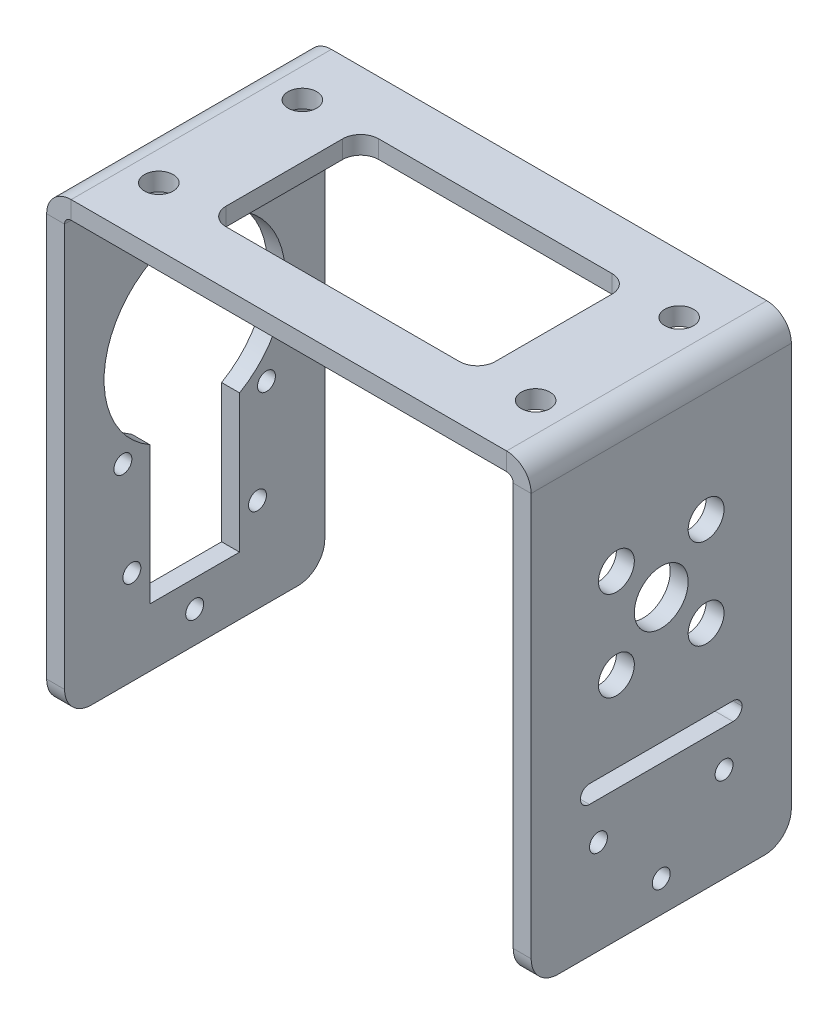
from build123d import *

# Parameters (mm, degrees)
SKETCH_1_W                       = 50
SKETCH_1_H                       = 29
SM_BASE_FLANGE_1_DEPTH           = 2
SM_EDGE_FLANGE_1_STRIP_W         = 9.4732
SM_EDGE_FLANGE_1_STRIP_H         = 2
SM_EDGE_FLANGE_1_STRIP_CUT_DEPTH = 29
SM_EDGE_FLANGE_1_DEPTH           = 29
CUT_EXTRUDE_1_REACH              = 74.671
SKETCH_9_R                       = 1
SM_EDGE_FLANGE_2_STRIP_W         = 9.4732
SM_EDGE_FLANGE_2_STRIP_H         = 2
SM_EDGE_FLANGE_2_STRIP_CUT_DEPTH = 29
SM_EDGE_FLANGE_2_DEPTH           = 29
CUT_EXTRUDE_2_REACH              = 76.115
SKETCH_13_R                      = 3
SKETCH_13_R_2                    = 2
SKETCH_13_R_3                    = 1
SKETCH_13_W                      = 18
SKETCH_13_H                      = 2
FILLET_1_R                       = 3
CUT_EXTRUDE_3_REACH              = 61.2
SKETCH_14_R                      = 1.6
SKETCH_14_W                      = 30
SKETCH_14_H                      = 17
FILLET_2_R                       = 2
EXTRUDE_1_DEPTH                  = 5
FILLET_3_R                       = 1


# Sheet-metal steps are written as plain solids
with BuildPart() as part:
    # Sketch 1 → 基体-法兰1 (new body)
    with BuildSketch(Plane(origin=(0, 0, 0), x_dir=(1, 0, 0), z_dir=(0, 1, 0))):
        Rectangle(SKETCH_1_W, SKETCH_1_H)
    extrude(amount=SM_BASE_FLANGE_1_DEPTH)

    # 边线-法兰1 strip (across the edge) → 边线-法兰1 strip cut (cut)
    with BuildSketch(Plane(origin=(-25, 0, 14.5), x_dir=(1, 0, 0), z_dir=(0, 0, -1))):
        with Locations((-4, -1)):
            Rectangle(SM_EDGE_FLANGE_1_STRIP_W, SM_EDGE_FLANGE_1_STRIP_H)
    extrude(amount=SM_EDGE_FLANGE_1_STRIP_CUT_DEPTH, mode=Mode.SUBTRACT)

    # 边线-法兰1 section (across the edge) → 边线-法兰1 (add)
    with BuildSketch(Plane(origin=(-25, 0, 14.5), x_dir=(1, 0, 0), z_dir=(0, 0, -1))):
        with BuildLine():
            Line((-2, 0.7366), (-2, 48.65))
            Line((-2, 48.65), (0, 48.65))
            Line((0, 48.65), (0, 0.7366))
            ThreePointArc((0, 0.7366), (0.215745145, 0.215745145), (0.7366, 0))
            Line((0.7366, 0), (0.7366, -2))
            ThreePointArc((0.7366, -2), (-1.198468417, -1.198468417), (-2, 0.7366))
        make_face()
    extrude(amount=SM_EDGE_FLANGE_1_DEPTH)

    # 草图9 → 切除-拉伸1 (cut, up to next)
    with BuildSketch(Plane.ZY.offset(27), mode=Mode.PRIVATE) as cut_extrude_1_sk1:
        with Locations(Location((-8, -27.15, 0), (0, 0, 270))):
            Circle(SKETCH_9_R)
    cut_extrude_1_tool1 = extrude(cut_extrude_1_sk1.sketch, amount=-CUT_EXTRUDE_1_REACH, mode=Mode.PRIVATE) & part.part
    # 草图9 → 切除-拉伸1 (cut, up to next)
    with BuildSketch(Plane.ZY.offset(27), mode=Mode.PRIVATE) as cut_extrude_1_sk2:
        with Locations(Location((-7, -38.15, 0), (0, 0, 270))):
            Circle(SKETCH_9_R)
    cut_extrude_1_tool2 = extrude(cut_extrude_1_sk2.sketch, amount=-CUT_EXTRUDE_1_REACH, mode=Mode.PRIVATE) & part.part
    # 草图9 → 切除-拉伸1 (cut, up to next)
    with BuildSketch(Plane.ZY.offset(27), mode=Mode.PRIVATE) as cut_extrude_1_sk3:
        with Locations(Location((0, -45.15, 0), (0, 0, 270))):
            Circle(SKETCH_9_R)
    cut_extrude_1_tool3 = extrude(cut_extrude_1_sk3.sketch, amount=-CUT_EXTRUDE_1_REACH, mode=Mode.PRIVATE) & part.part
    # 草图9 → 切除-拉伸1 (cut, up to next)
    with BuildSketch(Plane.ZY.offset(27), mode=Mode.PRIVATE) as cut_extrude_1_sk4:
        with Locations(Location((7, -38.15, 0), (0, 0, 90))):
            Circle(SKETCH_9_R)
    cut_extrude_1_tool4 = extrude(cut_extrude_1_sk4.sketch, amount=-CUT_EXTRUDE_1_REACH, mode=Mode.PRIVATE) & part.part
    # 草图9 → 切除-拉伸1 (cut, up to next)
    with BuildSketch(Plane.ZY.offset(27), mode=Mode.PRIVATE) as cut_extrude_1_sk5:
        with Locations(Location((8, -27.15, 0), (0, 0, 90))):
            Circle(SKETCH_9_R)
    cut_extrude_1_tool5 = extrude(cut_extrude_1_sk5.sketch, amount=-CUT_EXTRUDE_1_REACH, mode=Mode.PRIVATE) & part.part
    # 草图9 → 切除-拉伸1 (cut, up to next)
    with BuildSketch(Plane.ZY.offset(27), mode=Mode.PRIVATE) as cut_extrude_1_sk6:
        with BuildLine():
            Line((-5, -42.15), (-5, -26.775534172))
            ThreePointArc((-5, -26.775534172), (0, -7.9), (5, -26.775534172))
            Line((5, -26.775534172), (5, -42.15))
            Line((5, -42.15), (-5, -42.15))
        make_face()
    cut_extrude_1_tool6 = extrude(cut_extrude_1_sk6.sketch, amount=-CUT_EXTRUDE_1_REACH, mode=Mode.PRIVATE) & part.part
    add(cut_extrude_1_tool1.solids().sort_by_distance((-27, -27.15, -8))[0], mode=Mode.SUBTRACT)
    add(cut_extrude_1_tool2.solids().sort_by_distance((-27, -38.15, -7))[0], mode=Mode.SUBTRACT)
    add(cut_extrude_1_tool3.solids().sort_by_distance((-27, -45.15, 0))[0], mode=Mode.SUBTRACT)
    add(cut_extrude_1_tool4.solids().sort_by_distance((-27, -38.15, 7))[0], mode=Mode.SUBTRACT)
    add(cut_extrude_1_tool5.solids().sort_by_distance((-27, -27.15, 8))[0], mode=Mode.SUBTRACT)
    add(cut_extrude_1_tool6.solids().sort_by_distance((-27, -23.260924, 0))[0], mode=Mode.SUBTRACT)

    # 边线-法兰2 strip (across the edge) → 边线-法兰2 strip cut (cut)
    with BuildSketch(Plane(origin=(25, 0, -14.5), x_dir=(-1, 0, 0), z_dir=(0, 0, 1))):
        with Locations((-4, -1)):
            Rectangle(SM_EDGE_FLANGE_2_STRIP_W, SM_EDGE_FLANGE_2_STRIP_H)
    extrude(amount=SM_EDGE_FLANGE_2_STRIP_CUT_DEPTH, mode=Mode.SUBTRACT)

    # 边线-法兰2 section (across the edge) → 边线-法兰2 (add)
    with BuildSketch(Plane(origin=(25, 0, -14.5), x_dir=(-1, 0, 0), z_dir=(0, 0, 1))):
        with BuildLine():
            Line((-2, 0.7366), (-2, 48.65))
            Line((-2, 48.65), (0, 48.65))
            Line((0, 48.65), (0, 0.7366))
            ThreePointArc((0, 0.7366), (0.215745145, 0.215745145), (0.7366, 0))
            Line((0.7366, 0), (0.7366, -2))
            ThreePointArc((0.7366, -2), (-1.198468417, -1.198468417), (-2, 0.7366))
        make_face()
    extrude(amount=SM_EDGE_FLANGE_2_DEPTH)

    # 草图13 → 切除-拉伸2 (cut, up to next)
    with BuildSketch(Plane(origin=(27, 0, 0), x_dir=(0, 0, -1), z_dir=(1, 0, 0)), mode=Mode.PRIVATE) as cut_extrude_2_sk1:
        with Locations(Location((0, -18, 0), (0, 0, 90))):
            Circle(SKETCH_13_R)
    cut_extrude_2_tool1 = extrude(cut_extrude_2_sk1.sketch, amount=-CUT_EXTRUDE_2_REACH, mode=Mode.PRIVATE) & part.part
    # 草图13 → 切除-拉伸2 (cut, up to next)
    with BuildSketch(Plane(origin=(27, 0, 0), x_dir=(0, 0, -1), z_dir=(1, 0, 0)), mode=Mode.PRIVATE) as cut_extrude_2_sk2:
        with Locations(Location((-5, -13, 0), (0, 0, 90))):
            Circle(SKETCH_13_R_2)
    cut_extrude_2_tool2 = extrude(cut_extrude_2_sk2.sketch, amount=-CUT_EXTRUDE_2_REACH, mode=Mode.PRIVATE) & part.part
    # 草图13 → 切除-拉伸2 (cut, up to next)
    with BuildSketch(Plane(origin=(27, 0, 0), x_dir=(0, 0, -1), z_dir=(1, 0, 0)), mode=Mode.PRIVATE) as cut_extrude_2_sk3:
        with Locations(Location((5, -13, 0), (0, 0, 90))):
            Circle(SKETCH_13_R_2)
    cut_extrude_2_tool3 = extrude(cut_extrude_2_sk3.sketch, amount=-CUT_EXTRUDE_2_REACH, mode=Mode.PRIVATE) & part.part
    # 草图13 → 切除-拉伸2 (cut, up to next)
    with BuildSketch(Plane(origin=(27, 0, 0), x_dir=(0, 0, -1), z_dir=(1, 0, 0)), mode=Mode.PRIVATE) as cut_extrude_2_sk4:
        with Locations(Location((5, -23, 0), (0, 0, 90))):
            Circle(SKETCH_13_R_2)
    cut_extrude_2_tool4 = extrude(cut_extrude_2_sk4.sketch, amount=-CUT_EXTRUDE_2_REACH, mode=Mode.PRIVATE) & part.part
    # 草图13 → 切除-拉伸2 (cut, up to next)
    with BuildSketch(Plane(origin=(27, 0, 0), x_dir=(0, 0, -1), z_dir=(1, 0, 0)), mode=Mode.PRIVATE) as cut_extrude_2_sk5:
        with Locations(Location((-5, -23, 0), (0, 0, 90))):
            Circle(SKETCH_13_R_2)
    cut_extrude_2_tool5 = extrude(cut_extrude_2_sk5.sketch, amount=-CUT_EXTRUDE_2_REACH, mode=Mode.PRIVATE) & part.part
    # 草图13 → 切除-拉伸2 (cut, up to next)
    with BuildSketch(Plane(origin=(27, 0, 0), x_dir=(0, 0, -1), z_dir=(1, 0, 0)), mode=Mode.PRIVATE) as cut_extrude_2_sk6:
        with Locations(Location((0, -45.15, 0), (0, 0, 270))):
            Circle(SKETCH_13_R_3)
    cut_extrude_2_tool6 = extrude(cut_extrude_2_sk6.sketch, amount=-CUT_EXTRUDE_2_REACH, mode=Mode.PRIVATE) & part.part
    # 草图13 → 切除-拉伸2 (cut, up to next)
    with BuildSketch(Plane(origin=(27, 0, 0), x_dir=(0, 0, -1), z_dir=(1, 0, 0)), mode=Mode.PRIVATE) as cut_extrude_2_sk7:
        with Locations(Location((-7, -38.15, 0), (0, 0, 90))):
            Circle(SKETCH_13_R_3)
    cut_extrude_2_tool7 = extrude(cut_extrude_2_sk7.sketch, amount=-CUT_EXTRUDE_2_REACH, mode=Mode.PRIVATE) & part.part
    # 草图13 → 切除-拉伸2 (cut, up to next)
    with BuildSketch(Plane(origin=(27, 0, 0), x_dir=(0, 0, -1), z_dir=(1, 0, 0)), mode=Mode.PRIVATE) as cut_extrude_2_sk8:
        with Locations(Location((7, -38.15, 0), (0, 0, 270))):
            Circle(SKETCH_13_R_3)
    cut_extrude_2_tool8 = extrude(cut_extrude_2_sk8.sketch, amount=-CUT_EXTRUDE_2_REACH, mode=Mode.PRIVATE) & part.part
    # 草图13 → 切除-拉伸2 (cut, up to next)
    with BuildSketch(Plane(origin=(27, 0, 0), x_dir=(0, 0, -1), z_dir=(1, 0, 0)), mode=Mode.PRIVATE) as cut_extrude_2_sk9:
        with Locations((0, -33)):
            Rectangle(SKETCH_13_W, SKETCH_13_H)
    cut_extrude_2_tool9 = extrude(cut_extrude_2_sk9.sketch, amount=-CUT_EXTRUDE_2_REACH, mode=Mode.PRIVATE) & part.part
    add(cut_extrude_2_tool1.solids().sort_by_distance((27, -18, 0))[0], mode=Mode.SUBTRACT)
    add(cut_extrude_2_tool2.solids().sort_by_distance((27, -13, 5))[0], mode=Mode.SUBTRACT)
    add(cut_extrude_2_tool3.solids().sort_by_distance((27, -13, -5))[0], mode=Mode.SUBTRACT)
    add(cut_extrude_2_tool4.solids().sort_by_distance((27, -23, -5))[0], mode=Mode.SUBTRACT)
    add(cut_extrude_2_tool5.solids().sort_by_distance((27, -23, 5))[0], mode=Mode.SUBTRACT)
    add(cut_extrude_2_tool6.solids().sort_by_distance((27, -45.15, 0))[0], mode=Mode.SUBTRACT)
    add(cut_extrude_2_tool7.solids().sort_by_distance((27, -38.15, 7))[0], mode=Mode.SUBTRACT)
    add(cut_extrude_2_tool8.solids().sort_by_distance((27, -38.15, -7))[0], mode=Mode.SUBTRACT)
    add(cut_extrude_2_tool9.solids().sort_by_distance((27, -33, 0))[0], mode=Mode.SUBTRACT)

    # 圆角1
    fillet_1_edges = [part.edges().sort_by_distance(p)[0] for p in [
        (26, -48.65, -14.5),
        (26, -48.65, 14.5),
        (-26, -48.65, 14.5),
        (-26, -48.65, -14.5),
    ]]
    fillet(fillet_1_edges, radius=FILLET_1_R)

    # 草图14 → 切除-拉伸3 (cut, up to next)
    with BuildSketch(Plane(origin=(0, 2, 0), x_dir=(1, 0, 0), z_dir=(0, 1, 0)), mode=Mode.PRIVATE) as cut_extrude_3_sk1:
        with Locations(Location((-21, 8, 0), (0, 0, 270))):
            Circle(SKETCH_14_R)
    cut_extrude_3_tool1 = extrude(cut_extrude_3_sk1.sketch, amount=-CUT_EXTRUDE_3_REACH, mode=Mode.PRIVATE) & part.part
    # 草图14 → 切除-拉伸3 (cut, up to next)
    with BuildSketch(Plane(origin=(0, 2, 0), x_dir=(1, 0, 0), z_dir=(0, 1, 0)), mode=Mode.PRIVATE) as cut_extrude_3_sk2:
        with Locations(Location((-21, -8, 0), (0, 0, 270))):
            Circle(SKETCH_14_R)
    cut_extrude_3_tool2 = extrude(cut_extrude_3_sk2.sketch, amount=-CUT_EXTRUDE_3_REACH, mode=Mode.PRIVATE) & part.part
    # 草图14 → 切除-拉伸3 (cut, up to next)
    with BuildSketch(Plane(origin=(0, 2, 0), x_dir=(1, 0, 0), z_dir=(0, 1, 0)), mode=Mode.PRIVATE) as cut_extrude_3_sk3:
        with Locations(Location((21, -8, 0), (0, 0, 270))):
            Circle(SKETCH_14_R)
    cut_extrude_3_tool3 = extrude(cut_extrude_3_sk3.sketch, amount=-CUT_EXTRUDE_3_REACH, mode=Mode.PRIVATE) & part.part
    # 草图14 → 切除-拉伸3 (cut, up to next)
    with BuildSketch(Plane(origin=(0, 2, 0), x_dir=(1, 0, 0), z_dir=(0, 1, 0)), mode=Mode.PRIVATE) as cut_extrude_3_sk4:
        with Locations(Location((21, 8, 0), (0, 0, 270))):
            Circle(SKETCH_14_R)
    cut_extrude_3_tool4 = extrude(cut_extrude_3_sk4.sketch, amount=-CUT_EXTRUDE_3_REACH, mode=Mode.PRIVATE) & part.part
    # 草图14 → 切除-拉伸3 (cut, up to next)
    with BuildSketch(Plane(origin=(0, 2, 0), x_dir=(1, 0, 0), z_dir=(0, 1, 0)), mode=Mode.PRIVATE) as cut_extrude_3_sk5:
        Rectangle(SKETCH_14_W, SKETCH_14_H)
    cut_extrude_3_tool5 = extrude(cut_extrude_3_sk5.sketch, amount=-CUT_EXTRUDE_3_REACH, mode=Mode.PRIVATE) & part.part
    add(cut_extrude_3_tool1.solids().sort_by_distance((-21, 2, -8))[0], mode=Mode.SUBTRACT)
    add(cut_extrude_3_tool2.solids().sort_by_distance((-21, 2, 8))[0], mode=Mode.SUBTRACT)
    add(cut_extrude_3_tool3.solids().sort_by_distance((21, 2, 8))[0], mode=Mode.SUBTRACT)
    add(cut_extrude_3_tool4.solids().sort_by_distance((21, 2, -8))[0], mode=Mode.SUBTRACT)
    add(cut_extrude_3_tool5.solids().sort_by_distance((0, 2, 0))[0], mode=Mode.SUBTRACT)

    # 圆角2
    fillet_2_edges = [part.edges().sort_by_distance(p)[0] for p in [
        (-15, 1, 8.5),
        (-15, 1, -8.5),
        (15, 1, -8.5),
        (15, 1, 8.5),
    ]]
    fillet(fillet_2_edges, radius=FILLET_2_R)

    # 草图15 → 凸台-拉伸1 (add, symmetric)
    with BuildSketch(Plane.XY):
        with BuildLine():
            Line((-25, -7), (-18, 0))
            Line((-18, 0), (-24.2634, 0))
            ThreePointArc((-24.2634, 0), (-24.784254855, -0.215745145), (-25, -0.7366))
            Line((-25, -0.7366), (-25, -7))
        make_face()
    extrude_1 = extrude(amount=EXTRUDE_1_DEPTH, both=True)

    # 圆角3
    fillet_3_edges = [part.edges().sort_by_distance(p)[0] for p in [
        (26, -34, -9),
        (26, -32, -9),
        (26, -34, 9),
        (26, -32, 9),
    ]]
    fillet(fillet_3_edges, radius=FILLET_3_R - 0.0001)  # a hair under: the kernel refuses the full size

    # 镜向1: 凸台-拉伸1 across plane
    add(extrude_1.mirror(Plane(origin=(0, 0, 0), x_dir=(0, 0, 1), z_dir=(1, 0, 0))))


solid = part.part
